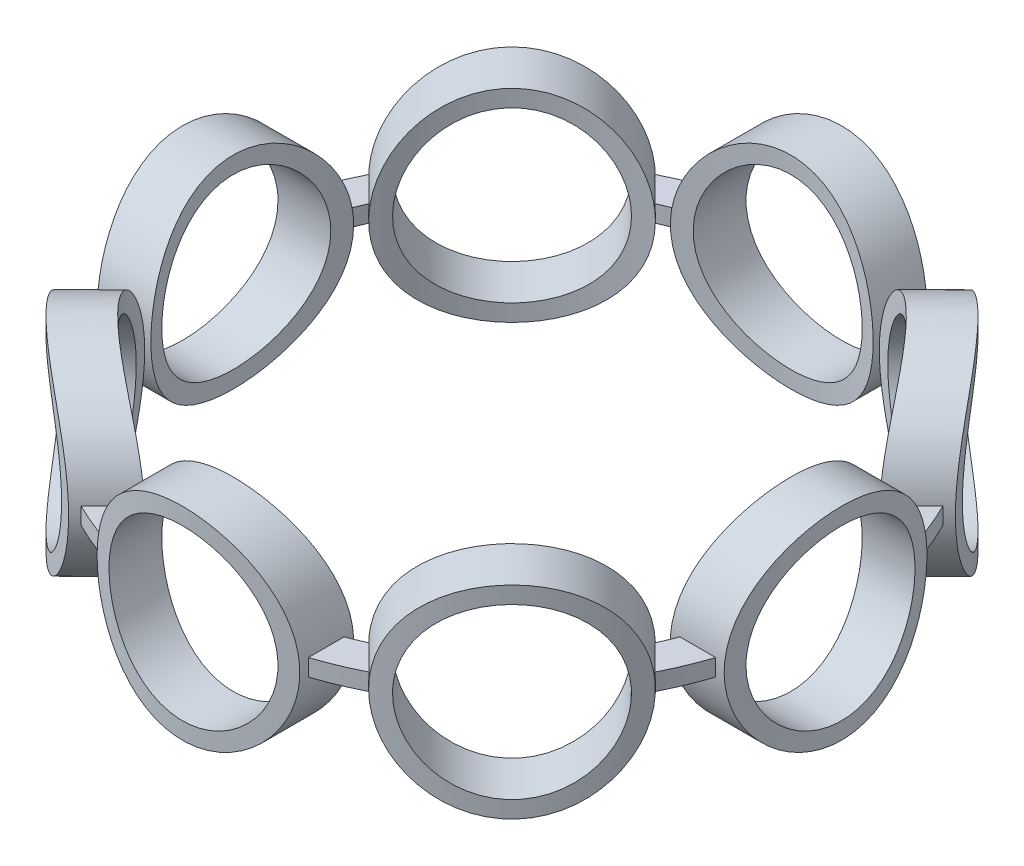
from build123d import *

# Parameters (mm, degrees)
SKETCH1_R              = 6
SKETCH1_R_2            = 5
EXTRUDE_THIN1_DEPTH    = 5
BALL_PATH_DIAMETER_R   = 19.5
BALL_PATH_DIAMETER_R_2 = 16.5
EXTRUDE_THIN2_DEPTH    = 10
EXTRUDE_THIN3_DEPTH    = 0.5
DELETEFACE1_START      = 16.248076708
DELETEFACE1_DEPTH      = 3.251918292
CIRPATTERN1_COUNT      = 8


with BuildPart() as part:
    # Sketch1 → Extrude-Thin1 (new, symmetric)
    with BuildSketch(Plane(origin=(0, 0, 18), x_dir=(0, 1, 0), z_dir=(0, 0, 1))):
        Circle(SKETCH1_R)
        Circle(SKETCH1_R_2, mode=Mode.SUBTRACT)
    extrude(amount=EXTRUDE_THIN1_DEPTH, both=True)


with BuildPart() as body_2:
    # ball path diameter → Extrude-Thin2 (new, symmetric)
    with BuildSketch(Plane(origin=(0, 0, 0), x_dir=(-1, 0, 0), z_dir=(0, 1, 0))):
        Circle(BALL_PATH_DIAMETER_R)
        Circle(BALL_PATH_DIAMETER_R_2, mode=Mode.SUBTRACT)
    extrude(amount=EXTRUDE_THIN2_DEPTH, both=True)

    # Intersect1: read off the stored shape, not the designer's step
    # Intersect1: intersect part
    add(part.part, mode=Mode.INTERSECT)

    # Sketch2 → Extrude-Thin3 (add, symmetric)
    with BuildSketch(Plane(origin=(0, 0, 0), x_dir=(-1, 0, 0), z_dir=(0, 1, 0))):
        with BuildLine():
            ThreePointArc((8.233333333, 17.123440724), (0, 19), (-8.233333333, 17.123440724))
            Line((-8.233333333, 17.123440724), (-7.366666667, 15.320973279))
            ThreePointArc((-7.366666667, 15.320973279), (0, 17), (7.366666667, 15.320973279))
            Line((7.366666667, 15.320973279), (8.233333333, 17.123440724))
        make_face()
    extrude(amount=EXTRUDE_THIN3_DEPTH, both=True)

    # DeleteFace1: read off the stored shape, not the designer's step
    # DeleteFace1 outline → DeleteFace1 (cut)
    with BuildSketch(Plane.XY.offset(DELETEFACE1_START)):
        with BuildLine():
            ThreePointArc((4.974937186, -0.5), (5, 0), (4.974937186, 0.5))
            Line((4.974937186, 0.5), (-4.974937186, 0.5))
            ThreePointArc((-4.974937186, 0.5), (-5, 0), (-4.974937186, -0.5))
            Line((-4.974937186, -0.5), (4.974937186, -0.5))
        make_face()
    extrude(amount=DELETEFACE1_DEPTH, mode=Mode.SUBTRACT)


with BuildPart() as cirpattern1_1:
    # CirPattern1: pattern copy
    add(body_2.part.rotate(Axis((0, 0, 0), (0, 1, 0)), 1 * 360 / CIRPATTERN1_COUNT))


with BuildPart() as cirpattern1_2:
    # CirPattern1: pattern copy
    add(body_2.part.rotate(Axis((0, 0, 0), (0, 1, 0)), 2 * 360 / CIRPATTERN1_COUNT))


with BuildPart() as cirpattern1_3:
    # CirPattern1: pattern copy
    add(body_2.part.rotate(Axis((0, 0, 0), (0, 1, 0)), 3 * 360 / CIRPATTERN1_COUNT))


with BuildPart() as cirpattern1_4:
    # CirPattern1: pattern copy
    add(body_2.part.rotate(Axis((0, 0, 0), (0, 1, 0)), 4 * 360 / CIRPATTERN1_COUNT))


with BuildPart() as cirpattern1_5:
    # CirPattern1: pattern copy
    add(body_2.part.rotate(Axis((0, 0, 0), (0, 1, 0)), 5 * 360 / CIRPATTERN1_COUNT))


with BuildPart() as cirpattern1_6:
    # CirPattern1: pattern copy
    add(body_2.part.rotate(Axis((0, 0, 0), (0, 1, 0)), 6 * 360 / CIRPATTERN1_COUNT))


with BuildPart() as cirpattern1_7:
    # CirPattern1: pattern copy
    add(body_2.part.rotate(Axis((0, 0, 0), (0, 1, 0)), 7 * 360 / CIRPATTERN1_COUNT))


with BuildPart() as body_2_1:
    add(body_2.part)

    # Combine1: union CirPattern1_7, CirPattern1_6, CirPattern1_5, CirPattern1_4, CirPattern1_3, CirPattern1_2, CirPattern1_1
    add(cirpattern1_7.part)
    add(cirpattern1_6.part)
    add(cirpattern1_5.part)
    add(cirpattern1_4.part)
    add(cirpattern1_3.part)
    add(cirpattern1_2.part)
    add(cirpattern1_1.part)


solid = body_2_1.part
